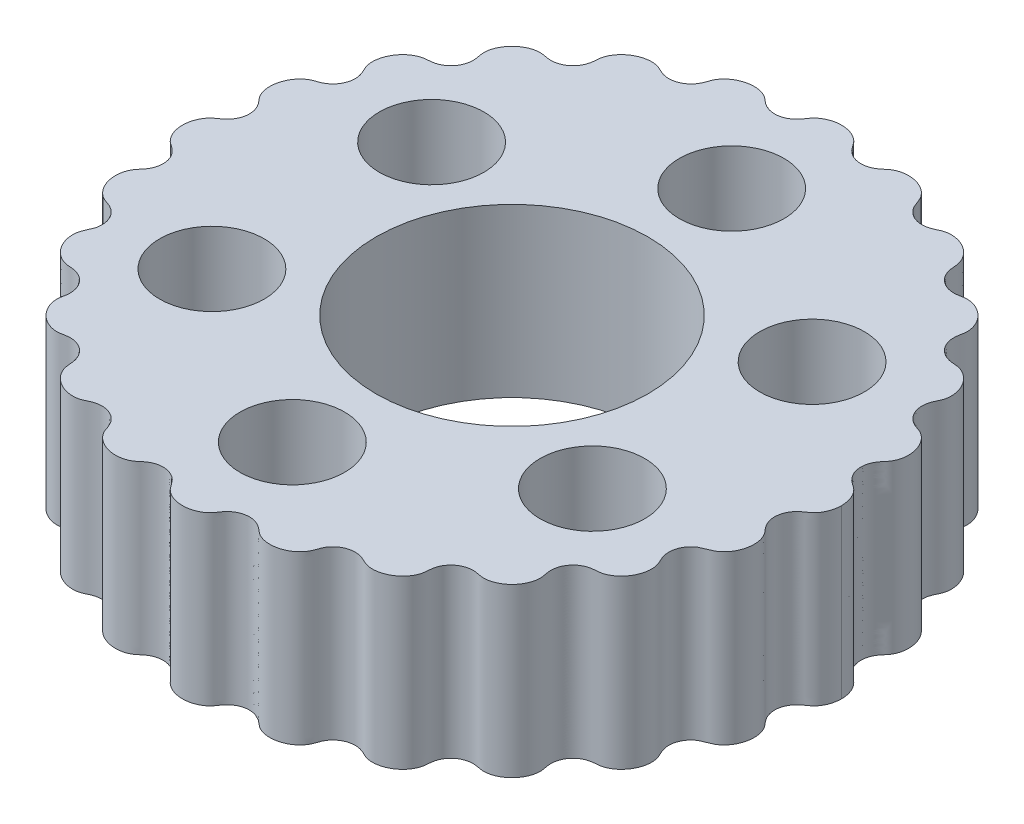
from build123d import *

# Parameters (mm, degrees)
BOSS_EXTRUDE1_DEPTH = 16
SKETCH3_R           = 13
SKETCH3_R_2         = 5
CUT_EXTRUDE1_DEPTH  = 48.333920573


# Read off the part's stored shape, not the designer's step: Boss-Extrude1
with BuildPart() as part:
    # Boss-Extrude1 outline → Boss-Extrude1 (new body)
    with BuildSketch(Plane(origin=(0, 0, 0), x_dir=(1, 0, 0), z_dir=(0, 1, 0))):
        with BuildLine():
            add(Edge.make_bspline(
                [(-31.5, 0), (-31.5, -0.183219945), (-31.466492172, -0.55090606), (-31.341036912, -0.992786711), (-31.196574662, -1.314833698), (-31.06762577, -1.538673049), (-30.947805994, -1.704397103), (-30.843077969, -1.826843938), (-30.762597886, -1.910938511), (-30.680084104, -1.987771216), (-30.604553838, -2.050501522), (-30.538756061, -2.100661647), (-30.488648652, -2.136835153), (-30.429649463, -2.177329542), (-30.352313245, -2.228732356), (-30.261379686, -2.290484499), (-30.180832373, -2.347374813), (-30.070399807, -2.428690335), (-29.916302218, -2.561483293), (-29.764051688, -2.715914833), (-29.565518504, -2.959912331), (-29.313120901, -3.438085626), (-29.200834263, -4.070138577), (-29.269339276, -4.618685495), (-29.417480631, -5.015248827), (-29.569864061, -5.289453397), (-29.689207143, -5.455812638), (-29.788217462, -5.57896471), (-29.865200685, -5.668580967), (-29.934168434, -5.74714131), (-29.985940984, -5.807085262), (-30.0301115, -5.860395243), (-30.068635623, -5.909324412), (-30.115795311, -5.972651609), (-30.168792887, -6.050597334), (-30.228383888, -6.150032987), (-30.301256517, -6.28901189), (-30.380441583, -6.476053181), (-30.45431327, -6.71961533), (-30.504623278, -6.977020829), (-30.538671598, -7.333246105), (-30.51728161, -7.792503757), (-30.389396418, -8.335636283), (-30.202910728, -8.758784459), (-30.012100231, -9.066415949), (-29.850576055, -9.278410279), (-29.67339608, -9.468601417), (-29.5156847, -9.606362573), (-29.385875083, -9.702611738), (-29.286893189, -9.767881822), (-29.18610479, -9.826442887), (-29.084786121, -9.87781913), (-28.995372355, -9.916885157), (-28.917467906, -9.947238917), (-28.848148816, -9.972366836), (-28.776082366, -9.99714893), (-28.699951051, -10.02302444), (-28.614178059, -10.0527583), (-28.49847929, -10.096433273), (-28.338778382, -10.162644571), (-28.120932897, -10.28058799), (-27.886466791, -10.436796851), (-27.550180323, -10.748896067), (-27.223777759, -11.276375639), (-27.081216566, -11.882857487), (-27.105484879, -12.483467351), (-27.215555209, -12.820488005), (-27.289051299, -13.01111393), (-27.343114534, -13.127301662), (-27.379722236, -13.203525389), (-27.417476386, -13.280168569), (-27.450291029, -13.347216921), (-27.481632679, -13.414264921), (-27.514738724, -13.489630329), (-27.550703943, -13.581273503), (-27.586187913, -13.689886253), (-27.615843959, -13.801738065), (-27.639698144, -13.917989693), (-27.663480225, -14.078230134), (-27.677574677, -14.28689666), (-27.668376356, -14.546679086), (-27.632676674, -14.810856179), (-27.55008053, -15.163291851), (-27.382728496, -15.594366284), (-27.089114926, -16.068838089), (-26.779484223, -16.408719801), (-26.503534142, -16.63651936), (-26.285925761, -16.782972343), (-26.06145902, -16.902965244), (-25.873288978, -16.979198329), (-25.723313751, -17.025994976), (-25.611106746, -17.054115969), (-25.518317582, -17.071788203), (-25.440024212, -17.083251018), (-25.378788938, -17.090531514), (-25.310480029, -17.096915039), (-25.225856707, -17.103243141), (-25.133170375, -17.10897628), (-25.001503955, -17.119147939), (-24.858552581, -17.135071296), (-24.647622142, -17.167809819), (-24.338164535, -17.259756224), (-23.977206223, -17.421830088), (-23.52040981, -17.77327795), (-23.157459801, -18.301816105), (-22.999939902, -18.807131995), (-22.966114003, -19.134262477), (-22.96559183, -19.338063571), (-22.979040094, -19.537046699), (-23.001785663, -19.688475258), (-23.01928136, -19.786068677), (-23.037197273, -19.879769135), (-23.055592354, -19.972767304), (-23.070054341, -20.05061728), (-23.080017934, -20.111759198), (-23.090649455, -20.19024056), (-23.099537367, -20.28621507), (-23.103601878, -20.4017267), (-23.101061429, -20.518846029), (-23.088742703, -20.677093965), (-23.056078325, -20.880669708), (-22.98895211, -21.129559949), (-22.863671054, -21.458987284), (-22.641959654, -21.857673241), (-22.285915131, -22.285863889), (-21.857630179, -22.641999602), (-21.459044481, -22.863635988), (-21.129384458, -22.989020184), (-20.880954852, -23.056018405), (-20.677123085, -23.088715032), (-20.518471861, -23.10108296), (-20.401418711, -23.103640023), (-20.286520203, -23.099579938), (-20.192095403, -23.090787579), (-20.111219163, -23.079852879), (-20.045779535, -23.069222559), (-19.97261152, -23.055854337), (-19.886251096, -23.03832222), (-19.786548779, -23.019504321), (-19.685836451, -23.000202126), (-19.492956615, -22.976600526), (-19.26081645, -22.953766551), (-18.793784893, -23.001364142), (-18.297233068, -23.162856831), (-17.785514256, -23.507604546), (-17.412549644, -23.990274243), (-17.26319143, -24.333060878), (-17.168250366, -24.640801459), (-17.133582798, -24.869702756), (-17.119622507, -25.00023447), (-17.109702453, -25.12046261), (-17.102494514, -25.232121311), (-17.096573251, -25.315058649), (-17.090717881, -25.378019448), (-17.083451721, -25.439175497), (-17.07203913, -25.516766046), (-17.053989604, -25.611402695), (-17.025762208, -25.724058035), (-16.97925757, -25.873236783), (-16.903125324, -26.061115586), (-16.782853699, -26.286096247), (-16.636493185, -26.503579652), (-16.408819835, -26.779378432), (-16.068767936, -27.089171443), (-15.594404383, -27.382711265), (-15.163285859, -27.550074468), (-14.810743362, -27.632710252), (-14.546871791, -27.668357535), (-14.287018777, -27.677557573), (-14.077635923, -27.663431926), (-13.918107531, -27.639761607), (-13.80257409, -27.616022151), (-13.690110718, -27.58621478), (-13.580063909, -27.550211841), (-13.489575603, -27.514829018), (-13.413756432, -27.481505442), (-13.3535838, -27.453276503), (-13.281015858, -27.417552938), (-13.19745906, -27.376654687), (-13.119257301, -27.339279092), (-13.0201416, -27.294427328), (-12.855711115, -27.225178051), (-12.607466404, -27.152016159), (-12.340819504, -27.100012945), (-11.886279632, -27.078863489), (-11.261252288, -27.231594134), (-10.764098415, -27.538921342), (-10.325538885, -28.005704477), (-10.185613358, -28.301749322), (-10.094310899, -28.49824558), (-10.051760169, -28.618716419), (-10.024926978, -28.694034283), (-9.996059933, -28.77909803), (-9.972225992, -28.848639404), (-9.94760195, -28.916525669), (-9.916695217, -28.99582297), (-9.877871176, -29.084667964), (-9.82642703, -29.186138331), (-9.767872607, -29.286909354), (-9.702638947, -29.385839032), (-9.606363682, -29.515679049), (-9.46858503, -29.673414241), (-9.278426851, -29.85056252), (-9.066418305, -30.012098079), (-8.758780576, -30.20291333), (-8.335638951, -30.389394199), (-7.792514569, -30.517280726), (-7.333237984, -30.538671755), (-6.977037099, -30.50462527), (-6.719616391, -30.454312866), (-6.476023364, -30.38043206), (-6.289071501, -30.301285395), (-6.149981102, -30.228351631), (-6.050673233, -30.16884468), (-5.972552428, -30.115722519), (-5.909179807, -30.068537732), (-5.860680607, -30.030341802), (-5.808323452, -29.986922943), (-5.742069288, -29.929950095), (-5.676028024, -29.871437525), (-5.571993203, -29.782432829), (-5.463238562, -29.695454253), (-5.287834706, -29.567102379), (-5.004379998, -29.413928941), (-4.637053026, -29.274134604), (-4.064140363, -29.198352639), (-3.429154343, -29.318331745), (-2.973163662, -29.556907603), (-2.621017483, -29.840734466), (-2.456774176, -30.03763177), (-2.346439208, -30.180265932), (-2.285422691, -30.269090183), (-2.228152849, -30.35350908), (-2.181162988, -30.424217119), (-2.137292047, -30.487757306), (-2.099254715, -30.540583738), (-2.049855661, -30.605380436), (-1.989141691, -30.678582026), (-1.910504036, -30.763001104), (-1.826479699, -30.843417186), (-1.705140294, -30.947203987), (-1.537975243, -31.068150749), (-1.315020838, -31.196394278), (-0.993160441, -31.340880639), (-0.554648335, -31.465986218), (1.3458e-05, -31.51700619), (0.55461386, -31.465991025), (0.993195123, -31.340868698), (1.314953579, -31.196426526), (1.538043831, -31.06810619), (1.705187844, -30.947169148), (1.826200532, -30.843666056), (1.91086959, -30.762609033), (1.988900893, -30.678873324), (2.04987394, -30.605380869), (2.099130996, -30.540713578), (2.137596211, -30.487355575), (2.180903624, -30.424577141), (2.228441447, -30.353122914), (2.284971682, -30.269681791), (2.347470149, -30.17902247), (2.454891221, -30.039574526), (2.62256037, -29.839836748), (2.970472505, -29.558438773), (3.431247037, -29.317594955), (4.061846392, -29.19861853), (4.638388151, -29.273995931), (5.007353095, -29.415571608), (5.281380569, -29.563529418), (5.463767338, -29.695020698), (5.580543, -29.789850881), (5.665135266, -29.86229659), (5.743867349, -29.931048872), (5.811207973, -29.989304802), (5.861891188, -30.031401251), (5.908473019, -30.068109694), (5.971469846, -30.114982712), (6.050683208, -30.168805347), (6.150363892, -30.228533705), (6.289249372, -30.301389215), (6.4756844, -30.380318513), (6.719698522, -30.454322357), (6.977124096, -30.50463937), (7.333098516, -30.538669052), (7.79259839, -30.517274158), (8.335593913, -30.389402498), (8.758782836, -30.202914134), (9.066408547, -30.01210438), (9.278424448, -29.850564623), (9.468580068, -29.673419233), (9.606359908, -29.5156837), (9.702636207, -29.385843007), (9.767869818, -29.286913953), (9.826423827, -29.186144182), (9.877868629, -29.084673245), (9.916694184, -28.995825456), (9.947599393, -28.916532694), (9.972222446, -28.84864923), (9.996058414, -28.779102778), (10.024921396, -28.694050535), (10.051754503, -28.618732512), (10.094298451, -28.498277078), (10.185596311, -28.30178572), (10.325474825, -28.005814077), (10.763941968, -27.53905273), (11.261031206, -27.2316896), (11.886056357, -27.078879285), (12.340695833, -27.09999412), (12.607383331, -27.151995791), (12.855661579, -27.225158663), (13.02011704, -27.29441653), (13.119241857, -27.339271837), (13.197445605, -27.376648166), (13.281006433, -27.417548263), (13.353577227, -27.453273338), (13.413751161, -27.481503046), (13.489570299, -27.514826825), (13.580058849, -27.550210029), (13.690105471, -27.586213226), (13.80256874, -27.616020894), (13.918102008, -27.639760631), (14.077630121, -27.663431328), (14.287012742, -27.677557479), (14.546865619, -27.668358062), (14.810737134, -27.632711402), (15.16327968, -27.550076435), (15.594398504, -27.382714196), (16.068762705, -27.089175387), (16.408815362, -26.779383052), (16.636489449, -26.503584653), (16.782850555, -26.286101465), (16.903122822, -26.061120923), (16.979255658, -25.873242048), (17.025760726, -25.724063306), (17.05398843, -25.611408027), (17.072038213, -25.516771393), (17.083450976, -25.439181097), (17.090717266, -25.37802527), (17.096572727, -25.315065084), (17.102493903, -25.232130819), (17.109701415, -25.120477754), (17.119620797, -25.000252789), (17.133578916, -24.869736928), (17.168237051, -24.640867018), (17.263155458, -24.333162046), (17.412459245, -23.99044059), (17.785332438, -23.507774745), (18.297039888, -23.162947416), (18.793613935, -23.001396913), (19.260745776, -22.953759577), (19.492910734, -22.976597455), (19.68581314, -23.000197576), (19.786531092, -23.019501191), (19.886239167, -23.038319628), (19.972606138, -23.055853429), (20.045769298, -23.069220706), (20.111215155, -23.079852234), (20.19209143, -23.090787145), (20.286513632, -23.099579592), (20.401412452, -23.103639965), (20.518466803, -23.101083162), (20.677118172, -23.088715616), (20.880947347, -23.056020102), (21.129381178, -22.989021165), (21.459034067, -22.863641256), (21.857640582, -22.641991984), (22.285885215, -22.285889925), (22.641985517, -21.8576488), (22.863637339, -21.459042263), (22.989012557, -21.129405886), (23.056028784, -20.880908407), (23.088708482, -20.677181064), (23.101081254, -20.518483947), (23.103638066, -20.401340873), (23.099587312, -20.286699024), (23.090776729, -20.191853934), (23.079840878, -20.111200413), (23.069554239, -20.047593584), (23.054870625, -19.968002691), (23.039444813, -19.890228829), (23.019424734, -19.788596299), (22.999789475, -19.675678079), (22.979806569, -19.540691954), (22.965711398, -19.344144187), (22.965791133, -19.133359599), (23.00101127, -18.80335534), (23.156612124, -18.304092176), (23.520198806, -17.773124929), (23.977200336, -17.421974221), (24.337331791, -17.260000558), (24.649367755, -17.167372392), (24.854920495, -17.135643962), (25.004493246, -17.118788414), (25.130393196, -17.109281659), (25.22787132, -17.103026993), (25.310110177, -17.096973528), (25.378574488, -17.090554028), (25.440017688, -17.083248878), (25.518382039, -17.071774542), (25.611104227, -17.054117549), (25.723294208, -17.026001688), (25.873278419, -16.979201764), (26.061461985, -16.902963569), (26.285917352, -16.782977508), (26.503529458, -16.636522936), (26.779479958, -16.408723951), (27.089111297, -16.068842626), (27.382725034, -15.594373399), (27.550078854, -15.163297025), (27.632675504, -14.810862748), (27.668375759, -14.546685699), (27.677574755, -14.286902081), (27.663480832, -14.078235866), (27.639699238, -13.91799579), (27.615845108, -13.801743315), (27.586189616, -13.689891431), (27.550704454, -13.581275799), (27.514745075, -13.489645282), (27.48163186, -13.414263112), (27.450296815, -13.347229076), (27.417479849, -13.280175307), (27.379727701, -13.203537106), (27.343124009, -13.12731914), (27.289063003, -13.011150179), (27.215572331, -12.820499885), (27.105506252, -12.483661877), (27.0812132, -11.882898091), (27.223664771, -11.277074046), (27.549152213, -10.749639827), (27.889940929, -10.433963214), (28.119618821, -10.281829125), (28.331032792, -10.166197003), (28.506412616, -10.092834983), (28.619069105, -10.051378731), (28.690368424, -10.026381799), (28.773926011, -9.997620972), (28.852099457, -9.970841516), (28.919876821, -9.946365071), (28.994244377, -9.917446973), (29.083773005, -9.878307198), (29.186331636, -9.826271954), (29.287226838, -9.767656611), (29.386020162, -9.702532705), (29.515482971, -9.606545168), (29.673339984, -9.468643457), (29.850671577, -9.278290194), (30.012073039, -9.066468876), (30.202890123, -8.75881341), (30.389407304, -8.335622985), (30.517275562, -7.792518497), (30.53867243, -7.333244504), (30.504625478, -6.977034794), (30.454314744, -6.71962428), (30.380437742, -6.476042322), (30.301265416, -6.289028504), (30.228391176, -6.150047539), (30.168791174, -6.050595998), (30.115777796, -5.972626488), (30.068653885, -5.909345981), (30.030137995, -5.860427814), (29.986065461, -5.807247231), (29.933423814, -5.746227647), (29.866712574, -5.670412987), (29.78640646, -5.57677217), (29.691273975, -5.458253228), (29.569381549, -5.289588802), (29.415596965, -5.010592931), (29.271448681, -4.623824701), (29.199140575, -4.074961852), (29.317106697, -3.427905792), (29.560501481, -2.968461803), (29.836743046, -2.625837329), (30.042956129, -2.451848804), (30.176288437, -2.349687287), (30.26991417, -2.284659037), (30.357541167, -2.225641819), (30.416704275, -2.186228387), (30.4932005, -2.133440844), (30.538136438, -2.101063666), (30.606825192, -2.048777709), (30.678253622, -1.989375531), (30.762921468, -1.910596859), (30.843628387, -1.826239224), (30.946926271, -1.705519498), (31.068457715, -1.537292497), (31.196089005, -1.316424665), (31.289141961, -1.106553602), (31.345438102, -0.953526271), (31.391273355, -0.804295531), (31.418461905, -0.701318002), (31.454667211, -0.52772823), (31.468594049, -0.442031488), (31.488426988, -0.272324891), (31.492288109, -0.224284634), (31.49665689, -0.145689227), (31.499647262, -0.046556201), (31.5, -0.018707094), (31.5, 0.018707094), (31.499647262, 0.046556201), (31.49665689, 0.145689227), (31.492288109, 0.224284634), (31.488426988, 0.272324891), (31.468594049, 0.442031488), (31.454667211, 0.52772823), (31.418461905, 0.701318002), (31.391273355, 0.804295531), (31.345438102, 0.953526271), (31.289141961, 1.106553602), (31.196089005, 1.316424665), (31.068457715, 1.537292497), (30.946926271, 1.705519498), (30.843628387, 1.826239224), (30.762921468, 1.910596859), (30.678253622, 1.989375531), (30.606825192, 2.048777709), (30.538136438, 2.101063666), (30.4932005, 2.133440844), (30.416704275, 2.186228387), (30.357541167, 2.225641819), (30.26991417, 2.284659037), (30.176288437, 2.349687287), (30.042956129, 2.451848804), (29.836743046, 2.625837329), (29.560501481, 2.968461803), (29.317106697, 3.427905792), (29.199140575, 4.074961852), (29.271448681, 4.623824701), (29.415596965, 5.010592931), (29.569381549, 5.289588802), (29.691273975, 5.458253228), (29.78640646, 5.57677217), (29.866712574, 5.670412987), (29.933423814, 5.746227647), (29.986065461, 5.807247231), (30.030137995, 5.860427814), (30.068653885, 5.909345981), (30.115777796, 5.972626488), (30.168791174, 6.050595998), (30.228391176, 6.150047539), (30.301265416, 6.289028504), (30.380437742, 6.476042322), (30.454314744, 6.71962428), (30.504625478, 6.977034794), (30.53867243, 7.333244504), (30.517275562, 7.792518497), (30.389407304, 8.335622985), (30.202890123, 8.75881341), (30.012073039, 9.066468876), (29.850671577, 9.278290194), (29.673339984, 9.468643457), (29.515482971, 9.606545168), (29.386020162, 9.702532705), (29.287226838, 9.767656611), (29.186331636, 9.826271954), (29.083773005, 9.878307198), (28.994244377, 9.917446973), (28.919876821, 9.946365071), (28.852099457, 9.970841516), (28.773926011, 9.997620972), (28.690368424, 10.026381799), (28.619069105, 10.051378731), (28.506412616, 10.092834983), (28.331032792, 10.166197003), (28.119618821, 10.281829125), (27.889940929, 10.433963214), (27.549152213, 10.749639827), (27.223664771, 11.277074046), (27.0812132, 11.882898091), (27.105506252, 12.483661877), (27.215572331, 12.820499885), (27.289063003, 13.011150179), (27.343124009, 13.12731914), (27.379727701, 13.203537106), (27.417479849, 13.280175307), (27.450296815, 13.347229076), (27.48163186, 13.414263112), (27.514745075, 13.489645282), (27.550704454, 13.581275799), (27.586189616, 13.689891431), (27.615845108, 13.801743315), (27.639699238, 13.91799579), (27.663480832, 14.078235866), (27.677574755, 14.286902081), (27.668375759, 14.546685699), (27.632675504, 14.810862748), (27.550078854, 15.163297025), (27.382725034, 15.594373399), (27.089111297, 16.068842626), (26.779479958, 16.408723951), (26.503529458, 16.636522936), (26.285917352, 16.782977508), (26.061461985, 16.902963569), (25.873278419, 16.979201764), (25.723294208, 17.026001688), (25.611104227, 17.054117549), (25.518382039, 17.071774542), (25.440017688, 17.083248878), (25.378574488, 17.090554028), (25.310110177, 17.096973528), (25.22787132, 17.103026993), (25.130393196, 17.109281659), (25.004493246, 17.118788414), (24.854920495, 17.135643962), (24.649367755, 17.167372392), (24.337331791, 17.260000558), (23.977200336, 17.421974221), (23.520198806, 17.773124929), (23.156612124, 18.304092176), (23.00101127, 18.80335534), (22.965791133, 19.133359599), (22.965711398, 19.344144187), (22.979806569, 19.540691954), (22.999789475, 19.675678079), (23.019424734, 19.788596299), (23.039444813, 19.890228829), (23.054870625, 19.968002691), (23.069554239, 20.047593584), (23.079840878, 20.111200413), (23.090776729, 20.191853934), (23.099587312, 20.286699024), (23.103638066, 20.401340873), (23.101081254, 20.518483947), (23.088708482, 20.677181064), (23.056028784, 20.880908407), (22.989012557, 21.129405886), (22.863637339, 21.459042263), (22.641985517, 21.8576488), (22.285885215, 22.285889925), (21.857640582, 22.641991984), (21.459034067, 22.863641256), (21.129381178, 22.989021165), (20.880947347, 23.056020102), (20.677118172, 23.088715616), (20.518466803, 23.101083162), (20.401412452, 23.103639965), (20.286513632, 23.099579592), (20.19209143, 23.090787145), (20.111215155, 23.079852234), (20.045769298, 23.069220706), (19.972606138, 23.055853429), (19.886239167, 23.038319628), (19.786531092, 23.019501191), (19.68581314, 23.000197576), (19.492910734, 22.976597455), (19.260745776, 22.953759577), (18.793613935, 23.001396913), (18.297039888, 23.162947416), (17.785332438, 23.507774745), (17.412459245, 23.99044059), (17.263155458, 24.333162046), (17.168237051, 24.640867018), (17.133578916, 24.869736928), (17.119620797, 25.000252789), (17.109701415, 25.120477754), (17.102493903, 25.232130819), (17.096572727, 25.315065084), (17.090717266, 25.37802527), (17.083450976, 25.439181097), (17.072038213, 25.516771393), (17.05398843, 25.611408027), (17.025760726, 25.724063306), (16.979255658, 25.873242048), (16.903122822, 26.061120923), (16.782850555, 26.286101465), (16.636489449, 26.503584653), (16.408815362, 26.779383052), (16.068762705, 27.089175387), (15.594398504, 27.382714196), (15.16327968, 27.550076435), (14.810737134, 27.632711402), (14.546865619, 27.668358062), (14.287012742, 27.677557479), (14.077630121, 27.663431328), (13.918102008, 27.639760631), (13.80256874, 27.616020894), (13.690105471, 27.586213226), (13.580058849, 27.550210029), (13.489570299, 27.514826825), (13.413751161, 27.481503046), (13.353577227, 27.453273338), (13.281006433, 27.417548263), (13.197445605, 27.376648166), (13.119241857, 27.339271837), (13.02011704, 27.29441653), (12.855661579, 27.225158663), (12.607383331, 27.151995791), (12.340695833, 27.09999412), (11.886056357, 27.078879285), (11.261031206, 27.2316896), (10.763941968, 27.53905273), (10.325474825, 28.005814077), (10.185596311, 28.30178572), (10.094298451, 28.498277078), (10.051754503, 28.618732512), (10.024921396, 28.694050535), (9.996058414, 28.779102778), (9.972222446, 28.84864923), (9.947599393, 28.916532694), (9.916694184, 28.995825456), (9.877868629, 29.084673245), (9.826423827, 29.186144182), (9.767869818, 29.286913953), (9.702636207, 29.385843007), (9.606359908, 29.5156837), (9.468580068, 29.673419233), (9.278424448, 29.850564623), (9.066408547, 30.01210438), (8.758782836, 30.202914134), (8.335593913, 30.389402498), (7.79259839, 30.517274158), (7.333098516, 30.538669052), (6.977124096, 30.50463937), (6.719698522, 30.454322357), (6.4756844, 30.380318513), (6.289249372, 30.301389215), (6.150363892, 30.228533705), (6.050683208, 30.168805347), (5.971469846, 30.114982712), (5.908473019, 30.068109694), (5.861891188, 30.031401251), (5.811207973, 29.989304802), (5.743867349, 29.931048872), (5.665135266, 29.86229659), (5.580543, 29.789850881), (5.463767338, 29.695020698), (5.281380569, 29.563529418), (5.007353095, 29.415571608), (4.638388151, 29.273995931), (4.061846392, 29.19861853), (3.431247037, 29.317594955), (2.970472505, 29.558438773), (2.62256037, 29.839836748), (2.454891221, 30.039574526), (2.347470149, 30.17902247), (2.284971682, 30.269681791), (2.228441447, 30.353122914), (2.180903624, 30.424577141), (2.137596211, 30.487355575), (2.099130996, 30.540713578), (2.04987394, 30.605380869), (1.988900893, 30.678873324), (1.91086959, 30.762609033), (1.826200532, 30.843666056), (1.705187844, 30.947169148), (1.538043831, 31.06810619), (1.314953579, 31.196426526), (0.993195123, 31.340868698), (0.55461386, 31.465991025), (1.3458e-05, 31.51700619), (-0.554648335, 31.465986218), (-0.993160441, 31.340880639), (-1.315020838, 31.196394278), (-1.537975243, 31.068150749), (-1.705140294, 30.947203987), (-1.826479699, 30.843417186), (-1.910504036, 30.763001104), (-1.989141691, 30.678582026), (-2.049855661, 30.605380436), (-2.099254715, 30.540583738), (-2.137292047, 30.487757306), (-2.181162988, 30.424217119), (-2.228152849, 30.35350908), (-2.285422691, 30.269090183), (-2.346439208, 30.180265932), (-2.456774176, 30.03763177), (-2.621017483, 29.840734466), (-2.973163662, 29.556907603), (-3.429154343, 29.318331745), (-4.064140363, 29.198352639), (-4.637053026, 29.274134604), (-5.004379998, 29.413928941), (-5.287834706, 29.567102379), (-5.463238562, 29.695454253), (-5.571993203, 29.782432829), (-5.676028024, 29.871437525), (-5.742069288, 29.929950095), (-5.808323452, 29.986922943), (-5.860680607, 30.030341802), (-5.909179807, 30.068537732), (-5.972552428, 30.115722519), (-6.050673233, 30.16884468), (-6.149981102, 30.228351631), (-6.289071501, 30.301285395), (-6.476023364, 30.38043206), (-6.719616391, 30.454312866), (-6.977037099, 30.50462527), (-7.333237984, 30.538671755), (-7.792514569, 30.517280726), (-8.335638951, 30.389394199), (-8.758780576, 30.20291333), (-9.066418305, 30.012098079), (-9.278426851, 29.85056252), (-9.46858503, 29.673414241), (-9.606363682, 29.515679049), (-9.702638947, 29.385839032), (-9.767872607, 29.286909354), (-9.82642703, 29.186138331), (-9.877871176, 29.084667964), (-9.916695217, 28.99582297), (-9.94760195, 28.916525669), (-9.972225992, 28.848639404), (-9.996059933, 28.77909803), (-10.024926978, 28.694034283), (-10.051760169, 28.618716419), (-10.094310899, 28.49824558), (-10.185613358, 28.301749322), (-10.325538885, 28.005704477), (-10.764098415, 27.538921342), (-11.261252288, 27.231594134), (-11.886279632, 27.078863489), (-12.340819504, 27.100012945), (-12.607466404, 27.152016159), (-12.855711115, 27.225178051), (-13.0201416, 27.294427328), (-13.119257301, 27.339279092), (-13.19745906, 27.376654687), (-13.281015858, 27.417552938), (-13.3535838, 27.453276503), (-13.413756432, 27.481505442), (-13.489575603, 27.514829018), (-13.580063909, 27.550211841), (-13.690110718, 27.58621478), (-13.80257409, 27.616022151), (-13.918107531, 27.639761607), (-14.077635923, 27.663431926), (-14.287018777, 27.677557573), (-14.546871791, 27.668357535), (-14.810743362, 27.632710252), (-15.163285859, 27.550074468), (-15.594404383, 27.382711265), (-16.068767936, 27.089171443), (-16.408819835, 26.779378432), (-16.636493185, 26.503579652), (-16.782853699, 26.286096247), (-16.903125324, 26.061115586), (-16.97925757, 25.873236783), (-17.025762208, 25.724058035), (-17.053989604, 25.611402695), (-17.07203913, 25.516766046), (-17.083451721, 25.439175497), (-17.090717881, 25.378019448), (-17.096573251, 25.315058649), (-17.102494514, 25.232121311), (-17.109702453, 25.12046261), (-17.119622507, 25.00023447), (-17.133582798, 24.869702756), (-17.168250366, 24.640801459), (-17.26319143, 24.333060878), (-17.412549644, 23.990274243), (-17.785514256, 23.507604546), (-18.297233068, 23.162856831), (-18.793784893, 23.001364142), (-19.26081645, 22.953766551), (-19.492956615, 22.976600526), (-19.685836451, 23.000202126), (-19.786548779, 23.019504321), (-19.886251096, 23.03832222), (-19.97261152, 23.055854337), (-20.045779535, 23.069222559), (-20.111219163, 23.079852879), (-20.192095403, 23.090787579), (-20.286520203, 23.099579938), (-20.401418711, 23.103640023), (-20.518471861, 23.10108296), (-20.677123085, 23.088715032), (-20.880954852, 23.056018405), (-21.129384458, 22.989020184), (-21.459044481, 22.863635988), (-21.857630179, 22.641999602), (-22.285915131, 22.285863889), (-22.641959654, 21.857673241), (-22.863671054, 21.458987284), (-22.98895211, 21.129559949), (-23.056078325, 20.880669708), (-23.088742703, 20.677093965), (-23.101061429, 20.518846029), (-23.103601878, 20.4017267), (-23.099537367, 20.28621507), (-23.090649455, 20.19024056), (-23.080017934, 20.111759198), (-23.070054341, 20.05061728), (-23.055592354, 19.972767304), (-23.037197273, 19.879769135), (-23.01928136, 19.786068677), (-23.001785663, 19.688475258), (-22.979040094, 19.537046699), (-22.96559183, 19.338063571), (-22.966114004, 19.134262477), (-22.999939902, 18.807131995), (-23.157459801, 18.301816105), (-23.52040981, 17.77327795), (-23.977206223, 17.421830088), (-24.338164535, 17.259756224), (-24.647622142, 17.167809819), (-24.858552581, 17.135071296), (-25.001503955, 17.119147939), (-25.133170375, 17.10897628), (-25.225856707, 17.103243141), (-25.310480029, 17.096915039), (-25.378788938, 17.090531514), (-25.440024212, 17.083251018), (-25.518317582, 17.071788203), (-25.611106746, 17.054115969), (-25.723313751, 17.025994976), (-25.873288978, 16.979198329), (-26.06145902, 16.902965244), (-26.285925761, 16.782972343), (-26.503534142, 16.63651936), (-26.779484223, 16.408719801), (-27.089114926, 16.068838089), (-27.382728496, 15.594366284), (-27.55008053, 15.163291851), (-27.632676674, 14.810856179), (-27.668376356, 14.546679086), (-27.677574677, 14.28689666), (-27.663480225, 14.078230134), (-27.639698144, 13.917989693), (-27.615843959, 13.801738065), (-27.586187913, 13.689886253), (-27.550703943, 13.581273503), (-27.514738724, 13.489630329), (-27.481632679, 13.414264921), (-27.450291029, 13.347216921), (-27.417476386, 13.280168569), (-27.379722236, 13.203525389), (-27.343114534, 13.127301662), (-27.289051299, 13.01111393), (-27.215555209, 12.820488005), (-27.105484879, 12.483467351), (-27.081216566, 11.882857487), (-27.223777759, 11.276375639), (-27.550180323, 10.748896067), (-27.886466791, 10.436796851), (-28.120932897, 10.28058799), (-28.338778382, 10.162644571), (-28.49847929, 10.096433273), (-28.614178059, 10.0527583), (-28.699951051, 10.02302444), (-28.776082366, 9.99714893), (-28.848148816, 9.972366836), (-28.917467906, 9.947238917), (-28.995372355, 9.916885157), (-29.084786121, 9.87781913), (-29.18610479, 9.826442887), (-29.286893189, 9.767881822), (-29.385875083, 9.702611738), (-29.5156847, 9.606362573), (-29.67339608, 9.468601417), (-29.850576055, 9.278410279), (-30.012100231, 9.066415949), (-30.202910728, 8.758784459), (-30.389396418, 8.335636283), (-30.51728161, 7.792503757), (-30.538671598, 7.333246105), (-30.504623278, 6.977020829), (-30.45431327, 6.71961533), (-30.380441583, 6.476053181), (-30.301256517, 6.28901189), (-30.228383888, 6.150032987), (-30.168792887, 6.050597334), (-30.115795311, 5.972651609), (-30.068635623, 5.909324412), (-30.0301115, 5.860395243), (-29.985940984, 5.807085262), (-29.934168434, 5.74714131), (-29.865200685, 5.668580967), (-29.788217462, 5.57896471), (-29.689207143, 5.455812638), (-29.569864061, 5.289453397), (-29.417480631, 5.015248827), (-29.269339276, 4.618685495), (-29.200834263, 4.070138577), (-29.313120901, 3.438085626), (-29.565518504, 2.959912331), (-29.764051688, 2.715914833), (-29.916302218, 2.561483293), (-30.070399807, 2.428690335), (-30.180832373, 2.347374813), (-30.261379686, 2.290484499), (-30.352313245, 2.228732356), (-30.429649463, 2.177329542), (-30.488648652, 2.136835153), (-30.538756061, 2.100661647), (-30.604553838, 2.050501522), (-30.680084104, 1.987771216), (-30.762597886, 1.910938511), (-30.843077969, 1.826843938), (-30.947805994, 1.704397103), (-31.06762577, 1.538673049), (-31.196574662, 1.314833698), (-31.341036912, 0.992786711), (-31.466492172, 0.55090606), (-31.5, 0.183219945), (-31.5, 0)],
                knots=[0.071647033, 0.071647033, 0.071647033, 0.071647033, 0.078340048, 0.085033063, 0.088379571, 0.091726078, 0.095072586, 0.096745839, 0.098419093, 0.100092347, 0.101765601, 0.102602228, 0.103438855, 0.104275481, 0.105112108, 0.105530422, 0.105948735, 0.106367049, 0.106576205, 0.106785362, 0.106994519, 0.107203676, 0.107412832, 0.107621989, 0.107831146, 0.108040302, 0.108458616, 0.108876929, 0.109295243, 0.11013187, 0.110968497, 0.111805123, 0.11264175, 0.113478377, 0.115151631, 0.116824885, 0.118498138, 0.121844646, 0.125191154, 0.128537661, 0.131884169, 0.138577184, 0.145270199, 0.151963214, 0.155309721, 0.158656229, 0.162002737, 0.165349244, 0.167022498, 0.168695752, 0.170369005, 0.172042259, 0.173715513, 0.17455214, 0.175388767, 0.176225394, 0.176643707, 0.17706202, 0.177480334, 0.177898647, 0.178107804, 0.178316961, 0.178526117, 0.178735274, 0.178944431, 0.179153588, 0.179571901, 0.179990215, 0.180408528, 0.180826841, 0.181245155, 0.182081782, 0.182918409, 0.183755036, 0.185428289, 0.187101543, 0.188774797, 0.190448051, 0.192121304, 0.195467812, 0.198814319, 0.202160827, 0.205507335, 0.21220035, 0.218893365, 0.22558638, 0.228932887, 0.232279395, 0.235625902, 0.23897241, 0.240645664, 0.242318917, 0.243992171, 0.244828798, 0.245665425, 0.246502052, 0.247338679, 0.248175306, 0.248593619, 0.249011933, 0.249430246, 0.249639403, 0.249848559, 0.250057716, 0.250266873, 0.25047603, 0.250685186, 0.250894343, 0.2511035, 0.251521813, 0.251940127, 0.25235844, 0.253195067, 0.254031694, 0.254868321, 0.255704948, 0.257378201, 0.259051455, 0.260724709, 0.262397963, 0.26574447, 0.269090978, 0.272437485, 0.2791305, 0.285823515, 0.292516531, 0.299209546, 0.302556053, 0.305902561, 0.309249068, 0.310922322, 0.312595576, 0.31426883, 0.315942083, 0.31677871, 0.317615337, 0.318451964, 0.319288591, 0.319706904, 0.320125218, 0.320543531, 0.320961845, 0.321171001, 0.321380158, 0.321589315, 0.321798472, 0.322007628, 0.322216785, 0.322635098, 0.323053412, 0.323471725, 0.324308352, 0.325144979, 0.325981606, 0.326818233, 0.32765486, 0.329328114, 0.331001367, 0.332674621, 0.336021129, 0.339367636, 0.342714144, 0.346060651, 0.352753666, 0.359446681, 0.366139696, 0.369486204, 0.372832712, 0.376179219, 0.379525727, 0.38119898, 0.382872234, 0.384545488, 0.386218742, 0.387891995, 0.388728622, 0.389565249, 0.390401876, 0.39082019, 0.391238503, 0.391656816, 0.39207513, 0.392284287, 0.392493443, 0.3927026, 0.392911757, 0.393120913, 0.39333007, 0.393748384, 0.394166697, 0.394585011, 0.395003324, 0.395421637, 0.396258264, 0.397094891, 0.397931518, 0.399604772, 0.401278026, 0.402951279, 0.404624533, 0.406297787, 0.409644294, 0.412990802, 0.41633731, 0.419683817, 0.426376832, 0.433069847, 0.439762862, 0.44310937, 0.446455877, 0.449802385, 0.453148892, 0.454822146, 0.4564954, 0.458168654, 0.459005281, 0.459841908, 0.460678534, 0.461515161, 0.462351788, 0.462770102, 0.463188415, 0.463606729, 0.463815885, 0.464025042, 0.464234199, 0.464443355, 0.464652512, 0.464861669, 0.465279982, 0.465698296, 0.466116609, 0.466534923, 0.46737155, 0.468208176, 0.469044803, 0.46988143, 0.471554684, 0.473227938, 0.474901192, 0.476574445, 0.479920953, 0.48326746, 0.486613968, 0.493306983, 0.499999998, 0.506693013, 0.513386028, 0.516732536, 0.520079043, 0.523425551, 0.525098805, 0.526772058, 0.528445312, 0.530118566, 0.530955193, 0.53179182, 0.532628447, 0.533465073, 0.533883387, 0.5343017, 0.534720014, 0.535138327, 0.535347484, 0.535556641, 0.535765797, 0.535974954, 0.536184111, 0.536393268, 0.536811581, 0.537229894, 0.537648208, 0.538484835, 0.539321462, 0.540158089, 0.540994715, 0.541831342, 0.543504596, 0.54517785, 0.546851104, 0.550197611, 0.553544119, 0.556890626, 0.560237134, 0.566930149, 0.573623164, 0.580316179, 0.583662687, 0.587009194, 0.590355702, 0.593702209, 0.595375463, 0.597048717, 0.59872197, 0.600395224, 0.602068478, 0.602905105, 0.603741732, 0.604578359, 0.604996672, 0.605414986, 0.605833299, 0.606251612, 0.606669926, 0.606879083, 0.607088239, 0.607297396, 0.607506553, 0.60771571, 0.607924866, 0.60834318, 0.608761493, 0.609179807, 0.60959812, 0.610434747, 0.611271374, 0.612108001, 0.613781254, 0.615454508, 0.617127762, 0.618801016, 0.62047427, 0.623820777, 0.627167285, 0.630513792, 0.6338603, 0.640553315, 0.64724633, 0.653939345, 0.657285852, 0.66063236, 0.663978868, 0.667325375, 0.668998629, 0.670671883, 0.672345136, 0.673181763, 0.67401839, 0.674855017, 0.675691644, 0.676528271, 0.676946584, 0.677364898, 0.677783211, 0.677992368, 0.678201525, 0.678410681, 0.678619838, 0.678828995, 0.679038151, 0.679456465, 0.679874778, 0.680293092, 0.680711405, 0.681548032, 0.682384659, 0.683221286, 0.684057913, 0.685731167, 0.68740442, 0.689077674, 0.690750928, 0.694097435, 0.697443943, 0.70079045, 0.707483466, 0.714176481, 0.720869496, 0.727562511, 0.730909018, 0.734255526, 0.737602033, 0.739275287, 0.740948541, 0.742621795, 0.744295048, 0.745131675, 0.745968302, 0.746804929, 0.747641556, 0.748059869, 0.748478183, 0.748896496, 0.749105653, 0.74931481, 0.749523967, 0.749733123, 0.74994228, 0.750151437, 0.750360593, 0.75056975, 0.750988064, 0.751406377, 0.75182469, 0.752661317, 0.753497944, 0.754334571, 0.755171198, 0.756007825, 0.757681079, 0.759354332, 0.761027586, 0.764374094, 0.767720601, 0.771067109, 0.774413616, 0.781106631, 0.787799647, 0.794492662, 0.797839169, 0.801185677, 0.804532184, 0.807878692, 0.809551946, 0.811225199, 0.812898453, 0.814571707, 0.816244961, 0.817081587, 0.817918214, 0.818754841, 0.819173155, 0.819591468, 0.820009782, 0.820428095, 0.820846408, 0.821055565, 0.821264722, 0.821473879, 0.821683035, 0.821892192, 0.822101349, 0.822519662, 0.822937976, 0.823356289, 0.823774603, 0.824611229, 0.825447856, 0.826284483, 0.827957737, 0.829630991, 0.831304245, 0.832977498, 0.834650752, 0.83799726, 0.841343767, 0.844690275, 0.848036782, 0.854729797, 0.861422812, 0.868115827, 0.871462335, 0.874808843, 0.87815535, 0.881501858, 0.883175111, 0.884848365, 0.886521619, 0.887358246, 0.888194873, 0.8890315, 0.889868126, 0.890704753, 0.891123067, 0.89154138, 0.891959694, 0.89216885, 0.892378007, 0.892587164, 0.892796321, 0.893005477, 0.893214634, 0.893632947, 0.894051261, 0.894469574, 0.894887888, 0.895724515, 0.896561142, 0.897397768, 0.898234395, 0.899907649, 0.901580903, 0.903254157, 0.90492741, 0.908273918, 0.911620426, 0.914966933, 0.916640187, 0.918313441, 0.919986694, 0.921659948, 0.923333202, 0.925006456, 0.925843083, 0.926679709, 0.927516336, 0.928352963, 0.928352963, 0.92918959, 0.930026217, 0.930862844, 0.931699471, 0.933372725, 0.935045978, 0.936719232, 0.938392486, 0.94006574, 0.941738993, 0.945085501, 0.948432008, 0.951778516, 0.95345177, 0.955125024, 0.956798277, 0.958471531, 0.959308158, 0.960144785, 0.960981412, 0.961818039, 0.962236352, 0.962654665, 0.963072979, 0.963491292, 0.963700449, 0.963909606, 0.964118763, 0.964327919, 0.964537076, 0.964746233, 0.965164546, 0.96558286, 0.966001173, 0.9668378, 0.967674427, 0.968511054, 0.969347681, 0.970184307, 0.971857561, 0.973530815, 0.975204069, 0.978550576, 0.981897084, 0.985243591, 0.988590099, 0.995283114, 1.001976129, 1.008669144, 1.012015652, 1.015362159, 1.018708667, 1.022055174, 1.023728428, 1.025401682, 1.027074936, 1.028748189, 1.030421443, 1.03125807, 1.032094697, 1.032931324, 1.033349637, 1.033767951, 1.034186264, 1.034604578, 1.034813734, 1.035022891, 1.035232048, 1.035441204, 1.035650361, 1.035859518, 1.036277831, 1.036696145, 1.037114458, 1.037532772, 1.037951085, 1.038787712, 1.039624339, 1.040460966, 1.04213422, 1.043807473, 1.045480727, 1.047153981, 1.048827235, 1.052173742, 1.05552025, 1.058866757, 1.062213265, 1.06890628, 1.075599295, 1.08229231, 1.085638818, 1.088985325, 1.092331833, 1.09567834, 1.097351594, 1.099024848, 1.100698102, 1.101534728, 1.102371355, 1.103207982, 1.104044609, 1.104881236, 1.105299549, 1.105717863, 1.106136176, 1.106345333, 1.10655449, 1.106763646, 1.106972803, 1.10718196, 1.107391117, 1.107600273, 1.10780943, 1.108227743, 1.108646057, 1.10906437, 1.109900997, 1.110737624, 1.111574251, 1.112410878, 1.114084132, 1.115757385, 1.117430639, 1.119103893, 1.122450401, 1.125796908, 1.129143416, 1.135836431, 1.142529446, 1.149222461, 1.155915476, 1.159261983, 1.162608491, 1.165954999, 1.167628252, 1.169301506, 1.17097476, 1.172648014, 1.173484641, 1.174321267, 1.175157894, 1.175994521, 1.176412835, 1.176831148, 1.177249462, 1.177667775, 1.177876932, 1.178086088, 1.178295245, 1.178504402, 1.178713559, 1.178922715, 1.179341029, 1.179759342, 1.180177656, 1.181014282, 1.181850909, 1.182687536, 1.183524163, 1.18436079, 1.186034044, 1.187707298, 1.189380551, 1.192727059, 1.196073566, 1.199420074, 1.202766582, 1.209459597, 1.216152612, 1.222845627, 1.226192134, 1.229538642, 1.232885149, 1.236231657, 1.237904911, 1.239578164, 1.241251418, 1.242924672, 1.244597926, 1.245434553, 1.24627118, 1.247107806, 1.24752612, 1.247944433, 1.248362747, 1.24878106, 1.248990217, 1.249199374, 1.24940853, 1.249617687, 1.249826844, 1.250036001, 1.250454314, 1.250872627, 1.251290941, 1.251709254, 1.252127568, 1.252964195, 1.253800821, 1.254637448, 1.256310702, 1.257983956, 1.25965721, 1.261330463, 1.263003717, 1.266350225, 1.269696732, 1.27304324, 1.276389747, 1.283082762, 1.289775778, 1.296468793, 1.2998153, 1.303161808, 1.306508315, 1.309854823, 1.311528077, 1.31320133, 1.314874584, 1.315711211, 1.316547838, 1.317384465, 1.318221092, 1.319057719, 1.319476032, 1.319894345, 1.320312659, 1.320521816, 1.320730972, 1.320940129, 1.321149286, 1.321358442, 1.321567599, 1.321985913, 1.322404226, 1.32282254, 1.323240853, 1.32407748, 1.324914107, 1.325750734, 1.32658736, 1.328260614, 1.329933868, 1.331607122, 1.333280376, 1.336626883, 1.339973391, 1.343319898, 1.350012913, 1.356705928, 1.363398943, 1.370091959, 1.373438466, 1.376784974, 1.380131481, 1.381804735, 1.383477989, 1.385151242, 1.386824496, 1.387661123, 1.38849775, 1.389334377, 1.390171004, 1.390589317, 1.391007631, 1.391425944, 1.391844258, 1.392053414, 1.392262571, 1.392471728, 1.392680884, 1.392890041, 1.393099198, 1.393517511, 1.393935825, 1.394354138, 1.395190765, 1.396027392, 1.396864019, 1.397700646, 1.398537273, 1.400210526, 1.40188378, 1.403557034, 1.406903541, 1.410250049, 1.413596557, 1.416943064, 1.423636079, 1.430329094, 1.437022109, 1.440368617, 1.443715124, 1.447061632, 1.450408139, 1.452081393, 1.453754647, 1.455427901, 1.457101155, 1.458774408, 1.459611035, 1.460447662, 1.461284289, 1.461702602, 1.462120916, 1.462539229, 1.462957543, 1.463375856, 1.463585013, 1.46379417, 1.464003326, 1.464212483, 1.46442164, 1.464630797, 1.46504911, 1.465467423, 1.465885737, 1.46630405, 1.467140677, 1.467977304, 1.468813931, 1.470487185, 1.472160438, 1.473833692, 1.475506946, 1.4771802, 1.480526707, 1.483873215, 1.487219722, 1.49056623, 1.497259245, 1.50395226, 1.510645275, 1.513991783, 1.51733829, 1.520684798, 1.524031305, 1.525704559, 1.527377813, 1.529051067, 1.529887694, 1.53072432, 1.531560947, 1.532397574, 1.533234201, 1.533652515, 1.534070828, 1.534489141, 1.534698298, 1.534907455, 1.535116612, 1.535325768, 1.535534925, 1.535744082, 1.536162395, 1.536580709, 1.536999022, 1.537417336, 1.538253962, 1.539090589, 1.539927216, 1.540763843, 1.542437097, 1.544110351, 1.545783604, 1.547456858, 1.550803366, 1.554149873, 1.557496381, 1.564189396, 1.570882411, 1.577575426, 1.584268441, 1.587614949, 1.590961456, 1.594307964, 1.595981217, 1.597654471, 1.599327725, 1.601000979, 1.601837606, 1.602674233, 1.603510859, 1.604347486, 1.6047658, 1.605184113, 1.605602427, 1.605811583, 1.60602074, 1.606229897, 1.606439054, 1.60664821, 1.606857367, 1.607066524, 1.60727568, 1.607693994, 1.608112307, 1.608530621, 1.609367248, 1.610203875, 1.611040501, 1.611877128, 1.612713755, 1.614387009, 1.616060263, 1.617733516, 1.621080024, 1.624426532, 1.627773039, 1.631119547, 1.637812562, 1.644505577, 1.651198592, 1.654545099, 1.657891607, 1.661238115, 1.664584622, 1.666257876, 1.66793113, 1.669604383, 1.671277637, 1.672950891, 1.673787518, 1.674624145, 1.675460772, 1.675879085, 1.676297398, 1.676715712, 1.677134025, 1.677552339, 1.677761495, 1.677970652, 1.678179809, 1.678388966, 1.678598122, 1.678807279, 1.679225593, 1.679643906, 1.680062219, 1.680480533, 1.68131716, 1.682153787, 1.682990414, 1.684663667, 1.686336921, 1.688010175, 1.689683429, 1.691356682, 1.69470319, 1.698049697, 1.701396205, 1.704742713, 1.711435728, 1.718128743, 1.724821758, 1.728168265, 1.731514773, 1.73486128, 1.738207788, 1.739881042, 1.741554295, 1.743227549, 1.744064176, 1.744900803, 1.74573743, 1.746574057, 1.747410684, 1.747828997, 1.748247311, 1.748665624, 1.748874781, 1.749083937, 1.749293094, 1.749502251, 1.749711408, 1.749920564, 1.750129721, 1.750338878, 1.750757191, 1.751175505, 1.751593818, 1.752430445, 1.753267072, 1.754103699, 1.754940326, 1.756613579, 1.758286833, 1.759960087, 1.761633341, 1.764979848, 1.768326356, 1.771672863, 1.778365878, 1.785058894, 1.785058894, 1.785058894, 1.785058894], degree=3))
        make_face()
    extrude(amount=BOSS_EXTRUDE1_DEPTH)

    # Sketch3 → Cut-Extrude1 (cut, through all)
    with BuildSketch(Plane(origin=(0, 16, 0), x_dir=(1, 0, 0), z_dir=(0, 1, 0))):
        with Locations(Location((0, 0, 0), (0, 0, 270))):
            Circle(SKETCH3_R)
        with Locations(Location((0, 21, 0), (0, 0, 270))):
            Circle(SKETCH3_R_2)
        with Locations(Location((18.186533479, 10.5, 0), (0, 0, 270))):
            Circle(SKETCH3_R_2)
        with Locations(Location((18.186533479, -10.5, 0), (0, 0, 270))):
            Circle(SKETCH3_R_2)
        with Locations(Location((0, -21, 0), (0, 0, 270))):
            Circle(SKETCH3_R_2)
        with Locations(Location((-18.186533479, -10.5, 0), (0, 0, 270))):
            Circle(SKETCH3_R_2)
        with Locations(Location((-18.186533479, 10.5, 0), (0, 0, 270))):
            Circle(SKETCH3_R_2)
    extrude(amount=-CUT_EXTRUDE1_DEPTH, mode=Mode.SUBTRACT)


solid = part.part
